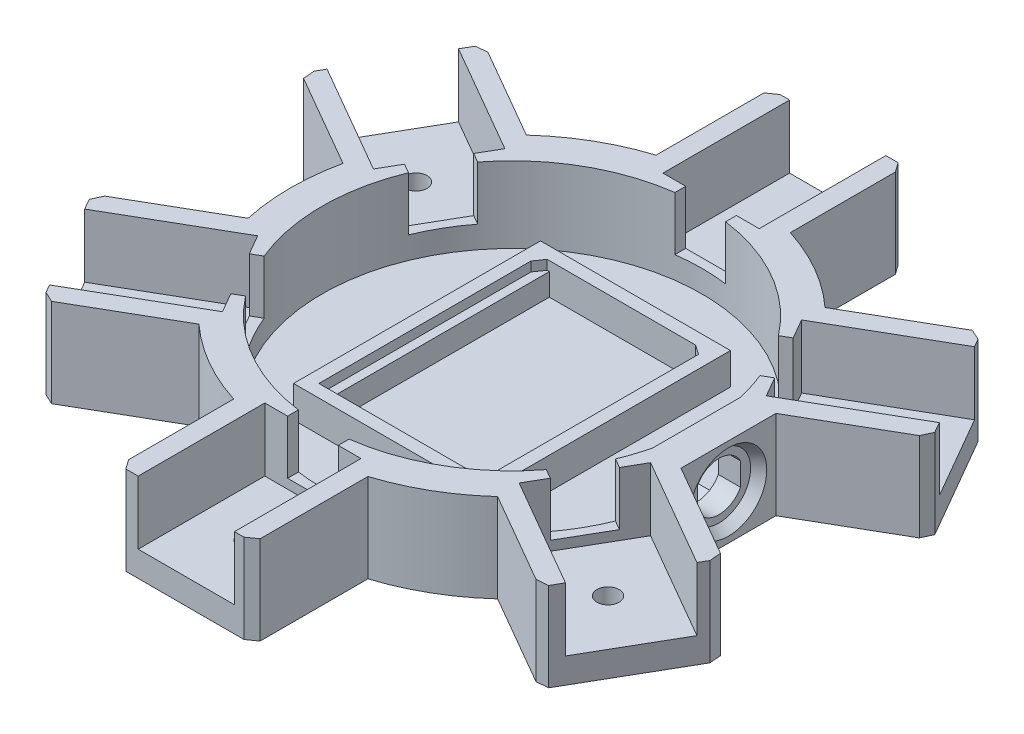
from build123d import *
from OCP.BRepFilletAPI import BRepFilletAPI_MakeChamfer

# Parameters (mm, degrees)
EXTRUDE_1_DEPTH     = 12
EXTRUDE_START       = 2
EXTRUDE_2_DEPTH     = 2
SKETCH_3_W          = 15.199999999999989
SKETCH_3_H          = 19.99999999999999
SKETCH_3_R          = 1.7500000000000004
SKETCH_3_R_2        = 1.7500000000005023
SKETCH_3_R_3        = 1.7500000000022933
SKETCH_3_R_4        = 1.7500000000036793
SKETCH_3_R_5        = 1.7500000000033842
SKETCH_3_R_6        = 1.7500000000018003
EXTRUDE_3_DEPTH     = 2
SKETCH_4_W          = 8
SKETCH_4_H          = 3.321565507275732
CUT_EXTRUDE_1_DEPTH = 8.5
CUT_EXTRUDE_2_DEPTH = 5
SKETCH_7_R          = 5
CUT_EXTRUDE_3_DEPTH = 1.5
CHAMFER_1_SIZE2     = 1.5
CHAMFER_1_SIZE      = 1.050311307
SKETCH_8_R          = 6.250000000000001
CUT_EXTRUDE_4_DEPTH = 5
SKETCH_6_W          = 30.000000000000018
SKETCH_6_H          = 39.00000000000001
EXTRUDE_4_DEPTH     = 5
EXTRUDE_5_DEPTH     = 3.5
CHAMFER_2_SIZE      = 1.5
CHAMFER_2_SIZE2     = 1.0503113073145682
SKETCH_10_R         = 1.7500000000000036
SKETCH_10_R_2       = 1.7500000000006353
SKETCH_10_R_3       = 1.750000000002967
SKETCH_10_R_4       = 1.750000000004767
SKETCH_10_R_5       = 1.7500000000043445
SKETCH_10_R_6       = 1.7500000000022113
CUT_EXTRUDE_5_DEPTH = 73.62872211301196
CHAMFER_3_SIZE      = 1.5
CHAMFER_3_SIZE2     = 1.0503113073145682
CHAMFER_3_SIZE2_2   = 1.0503113073145676
CHAMFER_3_SIZE2_3   = 1.050311307314569
CHAMFER_3_SIZE2_4   = 1.0503113073145678
CHAMFER_3_SIZE2_5   = 1.0503113073145673
CHAMFER_3_SIZE2_6   = 1.050311307314568


with BuildPart() as part:
    # Эскиз1 → Бобышка-Вытянуть1 (new body)
    with BuildSketch(Plane(origin=(0, 0, 0), x_dir=(1, 0, 0), z_dir=(0, 1, 0))):
        with BuildLine():
            Line((-7.599999999999993, 31.44), (-7.599999999999996, 51.44))
            Line((-7.599999999999996, 51.44), (-10.599999999999994, 51.44))
            Line((-10.599999999999994, 51.44), (-10.599999999999993, 33.35625878302303))
            ThreePointArc((-10.599999999999993, 33.35625878302303), (-17.499999999999947, 30.310889132455397), (-23.587367481305645, 25.857998671626635))
            Line((-23.587367481305645, 25.857998671626635), (-39.24834677067146, 34.8998692801151))
            Line((-39.24834677067146, 34.8998692801151), (-40.74834677067145, 32.30179306876178))
            Line((-40.74834677067145, 32.30179306876178), (-23.427838694982682, 22.3017930687618))
            Line((-23.427838694982682, 22.3017930687618), (-31.02783869498267, 9.138206931238326))
            Line((-31.02783869498267, 9.138206931238326), (-48.34834677067144, 19.138206931238315))
            Line((-48.34834677067144, 19.138206931238315), (-49.84834677067145, 16.540130719884996))
            Line((-49.84834677067145, 16.540130719884996), (-34.18736748130565, 7.498260111396523))
            ThreePointArc((-34.18736748130565, 7.498260111396523), (-34.99999999999993, 1.4417e-13), (-34.18736748130567, -7.49826011139625))
            Line((-34.18736748130567, -7.49826011139625), (-49.848346770671455, -16.540130719884772))
            Line((-49.848346770671455, -16.540130719884772), (-48.34834677067145, -19.138206931238084))
            Line((-48.34834677067145, -19.138206931238084), (-31.027838694982687, -9.138206931238079))
            Line((-31.027838694982687, -9.138206931238079), (-23.42783869498268, -22.301793068761537))
            Line((-23.42783869498268, -22.301793068761537), (-40.74834677067144, -32.301793068761555))
            Line((-40.74834677067144, -32.301793068761555), (-39.248346770671446, -34.89986928011487))
            Line((-39.248346770671446, -34.89986928011487), (-23.587367481305666, -25.85799867162636))
            ThreePointArc((-23.587367481305666, -25.85799867162636), (-17.49999999999999, -30.310889132455134), (-10.60000000000007, -33.35625878302277))
            Line((-10.60000000000007, -33.35625878302277), (-10.60000000000005, -51.439999999999756))
            Line((-10.60000000000005, -51.439999999999756), (-7.6000000000000485, -51.439999999999756))
            Line((-7.6000000000000485, -51.439999999999756), (-7.600000000000051, -31.43999999999976))
            Line((-7.600000000000051, -31.43999999999976), (7.599999999999947, -31.43999999999976))
            Line((7.599999999999947, -31.43999999999976), (7.59999999999995, -51.439999999999756))
            Line((7.59999999999995, -51.439999999999756), (10.59999999999995, -51.439999999999756))
            Line((10.59999999999995, -51.439999999999756), (10.599999999999941, -33.35625878302278))
            ThreePointArc((10.599999999999941, -33.35625878302278), (17.499999999999876, -30.310889132455145), (23.58736748130558, -25.85799867162641))
            Line((23.58736748130558, -25.85799867162641), (39.24834677067138, -34.899869280114885))
            Line((39.24834677067138, -34.899869280114885), (40.74834677067138, -32.30179306876157))
            Line((40.74834677067138, -32.30179306876157), (23.427838694982615, -22.30179306876157))
            Line((23.427838694982615, -22.30179306876157), (31.027838694982613, -9.138206931238104))
            Line((31.027838694982613, -9.138206931238104), (48.348346770671384, -19.138206931238102))
            Line((48.348346770671384, -19.138206931238102), (49.848346770671384, -16.540130719884782))
            Line((49.848346770671384, -16.540130719884782), (34.18736748130559, -7.498260111396299))
            Line((34.18736748130559, -7.498260111396299), (34.187367481305614, 7.498260111396479))
            Line((34.187367481305614, 7.498260111396479), (49.848346770671405, 16.540130719884996))
            Line((49.848346770671405, 16.540130719884996), (48.34834677067141, 19.13820693123831))
            Line((48.34834677067141, 19.13820693123831), (31.027838694982638, 9.138206931238308))
            Line((31.027838694982638, 9.138206931238308), (23.427838694982633, 22.301793068761775))
            Line((23.427838694982633, 22.301793068761775), (40.748346770671404, 32.301793068761775))
            Line((40.748346770671404, 32.301793068761775), (39.248346770671404, 34.89986928011509))
            Line((39.248346770671404, 34.89986928011509), (23.587367481305627, 25.857998671626596))
            ThreePointArc((23.587367481305627, 25.857998671626596), (17.499999999999936, 30.31088913245534), (10.600000000000003, 33.35625878302302))
            Line((10.600000000000003, 33.35625878302302), (10.600000000000001, 51.44))
            Line((10.600000000000001, 51.44), (7.600000000000002, 51.44))
            Line((7.600000000000002, 51.44), (7.599999999999993, 31.44))
            Line((7.599999999999993, 31.44), (-7.599999999999993, 31.44))
        make_face()
        with BuildLine():
            Line((29.18736748130573, 6.935241849511566), (29.18736748130574, -6.935241849511548))
            ThreePointArc((29.18736748130574, -6.935241849511548), (-29.999999999999996, -9.65e-15), (29.18736748130573, 6.935241849511566))
        make_face(mode=Mode.SUBTRACT)
    extrude(amount=EXTRUDE_1_DEPTH)

    # Эскиз2 → Бобышка-Вытянуть2 (add)
    with BuildSketch(Plane.XZ.offset(EXTRUDE_START)):
        with BuildLine():
            Line((-10.60000000000005, 51.439999999999756), (10.59999999999995, 51.439999999999756))
            Line((10.59999999999995, 51.439999999999756), (10.599999999999941, 33.35625878302278))
            ThreePointArc((10.599999999999941, 33.35625878302278), (17.499999999999883, 30.31088913245516), (23.58736748130557, 25.8579986716264))
            Line((23.58736748130557, 25.8579986716264), (39.24834677067138, 34.899869280114885))
            Line((39.24834677067138, 34.899869280114885), (49.848346770671384, 16.540130719884782))
            Line((49.848346770671384, 16.540130719884782), (34.18736748130559, 7.498260111396299))
            Line((34.18736748130559, 7.498260111396299), (34.187367481305614, -7.498260111396479))
            Line((34.187367481305614, -7.498260111396479), (49.848346770671405, -16.540130719884996))
            Line((49.848346770671405, -16.540130719884996), (39.248346770671404, -34.89986928011509))
            Line((39.248346770671404, -34.89986928011509), (23.587367481305627, -25.857998671626596))
            ThreePointArc((23.587367481305627, -25.857998671626596), (17.499999999999947, -30.310889132455358), (10.600000000000001, -33.356258783022994))
            Line((10.600000000000001, -33.356258783022994), (10.600000000000001, -51.44))
            Line((10.600000000000001, -51.44), (-10.599999999999994, -51.44))
            Line((-10.599999999999994, -51.44), (-10.599999999999993, -33.35625878302303))
            ThreePointArc((-10.599999999999993, -33.35625878302303), (-17.49999999999994, -30.310889132455387), (-23.587367481305638, -25.857998671626646))
            Line((-23.587367481305638, -25.857998671626646), (-39.24834677067146, -34.8998692801151))
            Line((-39.24834677067146, -34.8998692801151), (-48.34834677067144, -19.138206931238315))
            Line((-48.34834677067144, -19.138206931238315), (-49.84834677067145, -16.540130719884996))
            Line((-49.84834677067145, -16.540130719884996), (-34.18736748130565, -7.498260111396523))
            ThreePointArc((-34.18736748130565, -7.498260111396523), (-34.99999999999991, -1.356e-13), (-34.187367481305685, 7.498260111396258))
            Line((-34.187367481305685, 7.498260111396258), (-49.848346770671455, 16.540130719884772))
            Line((-49.848346770671455, 16.540130719884772), (-39.248346770671446, 34.89986928011487))
            Line((-39.248346770671446, 34.89986928011487), (-23.587367481305666, 25.85799867162636))
            ThreePointArc((-23.587367481305666, 25.85799867162636), (-17.50000000000001, 30.310889132455106), (-10.6000000000001, 33.35625878302277))
            Line((-10.6000000000001, 33.35625878302277), (-10.60000000000005, 51.439999999999756))
        make_face()
    extrude(amount=-EXTRUDE_2_DEPTH)

    # Эскиз3 → Бобышка-Вытянуть3 (add)
    # profile 1 of 6: a face of its own
    with BuildSketch(Plane(origin=(0, 0, 0), x_dir=(1, 0, 0), z_dir=(0, 1, 0))):
        with Locations((-2.22e-15, 41.44)):
            Rectangle(SKETCH_3_W, SKETCH_3_H)
        with Locations(Location((-1.73e-15, 41.440000000000005, 0), (0, 0, 270))):
            Circle(SKETCH_3_R, mode=Mode.SUBTRACT)
    # profile 2 of 6: a face of its own
    with BuildSketch(Plane(origin=(0, 0, 0), x_dir=(1, 0, 0), z_dir=(0, 1, 0))):
        Polygon((40.74834677067241, 32.301793068763274), (48.34834677067242, 19.13820693123983), (31.02783869498364, 9.138206931239816), (23.427838694983645, 22.30179306876327), align=None)
        with Locations(Location((35.88809273282802, 20.72000000000155, 0), (0, 0, 270))):
            Circle(SKETCH_3_R_2, mode=Mode.SUBTRACT)
    # profile 3 of 6: a face of its own
    with BuildSketch(Plane(origin=(0, 0, 0), x_dir=(1, 0, 0), z_dir=(0, 1, 0))):
        Polygon((48.34834677067419, -19.13820693123672), (40.74834677067421, -32.30179306876019), (23.427838694985432, -22.301793068760183), (31.027838694985423, -9.138206931236725), align=None)
        with Locations(Location((35.88809273282982, -20.719999999998457, 0), (0, 0, 270))):
            Circle(SKETCH_3_R_3, mode=Mode.SUBTRACT)
    # profile 4 of 6: a face of its own
    with BuildSketch(Plane(origin=(0, 0, 0), x_dir=(1, 0, 0), z_dir=(0, 1, 0))):
        Polygon((7.600000000003557, -51.44), (-7.599999999996428, -51.44000000000001), (-7.5999999999964345, -31.44), (7.600000000003551, -31.44), align=None)
        with Locations(Location((3.56008e-12, -41.440000000000005, 0), (0, 0, 270))):
            Circle(SKETCH_3_R_4, mode=Mode.SUBTRACT)
    # profile 5 of 6: a face of its own
    with BuildSketch(Plane(origin=(0, 0, 0), x_dir=(1, 0, 0), z_dir=(0, 1, 0))):
        Polygon((-40.74834677066884, -32.301793068763295), (-48.34834677066885, -19.13820693123985), (-31.02783869498008, -9.138206931239829), (-23.42783869498008, -22.30179306876328), align=None)
        with Locations(Location((-35.88809273282446, -20.720000000001555, 0), (0, 0, 270))):
            Circle(SKETCH_3_R_5, mode=Mode.SUBTRACT)
    # profile 6 of 6: a face of its own
    with BuildSketch(Plane(origin=(0, 0, 0), x_dir=(1, 0, 0), z_dir=(0, 1, 0))):
        Polygon((-48.348346770670645, 19.138206931236688), (-40.74834677067068, 32.30179306876016), (-23.427838694981887, 22.30179306876017), (-31.027838694981867, 9.138206931236708), align=None)
        with Locations(Location((-35.888092732826266, 20.719999999998436, 0), (0, 0, 270))):
            Circle(SKETCH_3_R_6, mode=Mode.SUBTRACT)
    extrude(amount=EXTRUDE_3_DEPTH)

    # Эскиз4 → Вырез-Вытянуть1 (cut)
    with BuildSketch(Plane(origin=(0, 12, 0), x_dir=(1, 0, 0), z_dir=(0, 1, 0))):
        Polygon((25.60639352508, 19.40266034819837), (29.606393525080005, 12.474457117922865), (26.729833415445075, 10.813674364285001), (22.72983341544507, 17.74187759456051), align=None)
        with Locations((0, 30.216334712480567)):
            Rectangle(SKETCH_4_W, SKETCH_4_H)
        Polygon((29.606393525081625, -12.474457117920053), (25.60639352508163, -19.402660348195564), (22.7298334154467, -17.7418775945577), (26.729833415446695, -10.81367436428219), align=None)
        Polygon((4.000000000003237, -31.87711746611843), (-3.999999999996763, -31.87711746611843), (-3.999999999996764, -28.555551958842702), (4.0000000000032365, -28.555551958842702), align=None)
        Polygon((-25.60639352507676, -19.40266034819838), (-29.606393525076765, -12.474457117922876), (-26.72983341544184, -10.813674364285008), (-22.729833415441835, -17.741877594560513), align=None)
        Polygon((-29.6063935250784, 12.474457117920036), (-25.606393525078403, 19.40266034819555), (-22.729833415443473, 17.74187759455769), (-26.72983341544347, 10.813674364282175), align=None)
    extrude(amount=-CUT_EXTRUDE_1_DEPTH, mode=Mode.SUBTRACT)

    # Эскиз5 → Вырез-Вытянуть2 (cut)
    with BuildSketch(Plane(origin=(34.1873674813056, 0, 4.746e-14), x_dir=(1.39e-15, 0, -1), z_dir=(1, 0, 1.39e-15))):
        with BuildLine():
            Line((-3.4, 6.806239186818845), (-3.3999999999999986, 3.1937608131811546))
            ThreePointArc((-3.3999999999999986, 3.1937608131811546), (7.316e-14, 1.1499999999998796), (3.4000000000000004, 3.1937608131811555))
            Line((3.4000000000000004, 3.1937608131811555), (3.4, 6.806239186818847))
            ThreePointArc((3.4, 6.806239186818847), (7.145e-14, 8.84999999999988), (-3.4, 6.806239186818845))
        make_face()
    extrude(amount=-CUT_EXTRUDE_2_DEPTH, mode=Mode.SUBTRACT)

    # Эскиз7 → Вырез-Вытянуть3 (cut)
    with BuildSketch(Plane(origin=(34.1873674813056, 0, 4.746e-14), x_dir=(1.39e-15, 0, -1), z_dir=(1, 0, 1.39e-15))):
        with Locations((1.3704e-13, 5)):
            Circle(SKETCH_7_R)
    extrude(amount=-CUT_EXTRUDE_3_DEPTH, mode=Mode.SUBTRACT)

    # Фаска1
    chamfer_1_edges = [part.edges().sort_by_distance(p)[0] for p in [
        (34.18736748130559, 5.000000000000001, 4.99999999999991),
    ]]
    chamfer_1_side = [part.faces().sort_by_distance(p)[0] for p in [
        (34.18736748130559, 5.000000000000001, 5.021006226146202),
    ]]
    chamfer(chamfer_1_edges, length=CHAMFER_1_SIZE - 0.0001, length2=CHAMFER_1_SIZE2 - 0.0001, reference=chamfer_1_side[0])  # a hair under: the kernel refuses the full size

    # Эскиз8 → Вырез-Вытянуть4 (cut)
    with BuildSketch(Plane.ZY.offset(-29.187367481305735)):
        with Locations((-7.532e-14, 5)):
            Circle(SKETCH_8_R)
    extrude(amount=CUT_EXTRUDE_4_DEPTH, mode=Mode.SUBTRACT)

    # Эскиз6 → Бобышка-Вытянуть4 (add)
    with BuildSketch(Plane(origin=(0, 0, 0), x_dir=(1, 0, 0), z_dir=(0, 1, 0))):
        Rectangle(SKETCH_6_W, SKETCH_6_H)
        Polygon((-13.000000000000002, 17.5), (12.999999999999995, 17.5), (13.000000000000002, -17.5), (-13.000000000000002, -17.5), align=None, mode=Mode.SUBTRACT)
    extrude(amount=EXTRUDE_4_DEPTH)

    # Эскиз9 → Бобышка-Вытянуть5 (add)
    with BuildSketch(Plane(origin=(0, 0, 0), x_dir=(1, 0, 0), z_dir=(0, 1, 0))):
        Polygon((-13.000000000000002, 17.5), (-11.600000000000001, 17.5), (-11.599999999999998, -16.1), (11.599999999999998, -16.1), (11.599999999999994, 17.5), (12.999999999999995, 17.5), (12.999999999999995, -17.5), (11.6, -17.5), (-11.599999999999996, -17.5), (-13.000000000000002, -17.5), align=None)
    extrude(amount=EXTRUDE_5_DEPTH)

    # Фаска2: one chamfer whose edges measure the first distance from different faces: ONE call of the kernel's chamfer builder (chamfer() names one face for all edges)
    chamfer_2_edges_1 = [part.edges().sort_by_distance(p)[0] for p in [
        (12.999999999999995, 4.25, -17.5),
    ]]
    chamfer_2_side_1 = [part.faces().sort_by_distance(p)[0] for p in [
        (-4.05e-15, 2.5611480865224623, -17.5),
    ]]
    chamfer_2_edges_2 = [part.edges().sort_by_distance(p)[0] for p in [
        (-13.000000000000002, 4.25, -17.5),
    ]]
    chamfer_2_side_2 = [part.faces().sort_by_distance(p)[0] for p in [
        (-13.000000000000002, 4.25, 6.7e-16),
    ]]
    chamfer_2 = BRepFilletAPI_MakeChamfer(part.part.solid().wrapped)
    for e in chamfer_2_edges_1:
        chamfer_2.Add(CHAMFER_2_SIZE, CHAMFER_2_SIZE2, e.wrapped, chamfer_2_side_1[0].wrapped)  # the first distance lies on this face
    for e in chamfer_2_edges_2:
        chamfer_2.Add(CHAMFER_2_SIZE, CHAMFER_2_SIZE2, e.wrapped, chamfer_2_side_2[0].wrapped)  # the first distance lies on this face
    add(Compound.cast(chamfer_2.Shape()), mode=Mode.REPLACE)

    # Эскиз10 → Вырез-Вытянуть5 (cut, through all)
    with BuildSketch(Plane(origin=(0, 0, 0), x_dir=(1, 0, 0), z_dir=(0, 1, 0))):
        with Locations(Location((-1.73e-15, 41.440000000000005, 0), (0, 0, 270))):
            Circle(SKETCH_10_R)
        with Locations(Location((35.8880927328283, 20.72000000000204, 0), (0, 0, 270))):
            Circle(SKETCH_10_R_2)
        with Locations(Location((35.88809273283067, -20.719999999997967, 0), (0, 0, 270))):
            Circle(SKETCH_10_R_3)
        with Locations(Location((4.69422e-12, -41.440000000000005, 0), (0, 0, 270))):
            Circle(SKETCH_10_R_4)
        with Locations(Location((-35.88809273282361, -20.72000000000205, 0), (0, 0, 270))):
            Circle(SKETCH_10_R_5)
        with Locations(Location((-35.88809273282598, 20.719999999997942, 0), (0, 0, 270))):
            Circle(SKETCH_10_R_6)
    extrude(amount=-CUT_EXTRUDE_5_DEPTH, mode=Mode.SUBTRACT)

    # Фаска3: one chamfer whose edges measure the first distance from different faces: ONE call of the kernel's chamfer builder (chamfer() names one face for all edges)
    chamfer_3_edges_1 = [part.edges().sort_by_distance(p)[0] for p in [
        (10.600000000000001, 5, -51.44),
    ]]
    chamfer_3_side_1 = [part.faces().sort_by_distance(p)[0] for p in [
        (10.600000000000001, 4.999999999999998, -42.3981293915115),
    ]]
    chamfer_3_edges_2 = [part.edges().sort_by_distance(p)[0] for p in [
        (39.248346770671404, 5, -34.89986928011509),
    ]]
    chamfer_3_side_2 = [part.faces().sort_by_distance(p)[0] for p in [
        (40.6213192146058, 7, -32.5218112498287),
    ]]
    chamfer_3_edges_3 = [part.edges().sort_by_distance(p)[0] for p in [
        (49.848346770671405, 5, -16.540130719884996),
    ]]
    chamfer_3_side_3 = [part.faces().sort_by_distance(p)[0] for p in [
        (42.017857125988506, 5, -12.019195415640738),
    ]]
    chamfer_3_edges_4 = [part.edges().sort_by_distance(p)[0] for p in [
        (49.848346770671384, 5, 16.540130719884782),
    ]]
    chamfer_3_side_4 = [part.faces().sort_by_distance(p)[0] for p in [
        (39.99834677067138, 11.745944887868793, 33.60083117443823),
    ]]
    chamfer_3_edges_5 = [part.edges().sort_by_distance(p)[0] for p in [
        (39.24834677067138, 5, 34.899869280114885),
    ]]
    chamfer_3_side_5 = [part.faces().sort_by_distance(p)[0] for p in [
        (31.417857125988476, 4.999999999999999, 30.37893397587065),
    ]]
    chamfer_3_edges_6 = [part.edges().sort_by_distance(p)[0] for p in [
        (10.59999999999995, 5, 51.439999999999756),
    ]]
    chamfer_3_side_6 = [part.faces().sort_by_distance(p)[0] for p in [
        (-9.10000000000005, 11.745944887868793, 51.439999999999756),
    ]]
    chamfer_3_edges_7 = [part.edges().sort_by_distance(p)[0] for p in [
        (-10.60000000000005, 5, 51.439999999999756),
    ]]
    chamfer_3_side_7 = [part.faces().sort_by_distance(p)[0] for p in [
        (-10.60000000000006, 5.000000000000001, 42.39812939151126),
    ]]
    chamfer_3_edges_8 = [part.edges().sort_by_distance(p)[0] for p in [
        (-39.248346770671446, 5, 34.89986928011487),
    ]]
    chamfer_3_side_8 = [part.faces().sort_by_distance(p)[0] for p in [
        (-49.09834677067145, 11.745944887868793, 17.83916882556143),
    ]]
    chamfer_3_edges_9 = [part.edges().sort_by_distance(p)[0] for p in [
        (-49.848346770671455, 5, 16.540130719884772),
    ]]
    chamfer_3_side_9 = [part.faces().sort_by_distance(p)[0] for p in [
        (-42.01785712598857, 5.000000000000002, 12.019195415640514),
    ]]
    chamfer_3_edges_10 = [part.edges().sort_by_distance(p)[0] for p in [
        (-49.84834677067145, 5, -16.540130719884996),
    ]]
    chamfer_3_side_10 = [part.faces().sort_by_distance(p)[0] for p in [
        (-39.99834677067146, 11.745944887868793, -33.60083117443844),
    ]]
    chamfer_3_edges_11 = [part.edges().sort_by_distance(p)[0] for p in [
        (-39.24834677067146, 5, -34.8998692801151),
    ]]
    chamfer_3_side_11 = [part.faces().sort_by_distance(p)[0] for p in [
        (-31.41785712598855, 5, -30.37893397587087),
    ]]
    chamfer_3_edges_12 = [part.edges().sort_by_distance(p)[0] for p in [
        (-10.599999999999994, 5, -51.44),
    ]]
    chamfer_3_side_12 = [part.faces().sort_by_distance(p)[0] for p in [
        (9.100000000000001, 11.745944887868793, -51.44),
    ]]
    chamfer_3 = BRepFilletAPI_MakeChamfer(part.part.solid().wrapped)
    for e in chamfer_3_edges_1:
        chamfer_3.Add(CHAMFER_3_SIZE, CHAMFER_3_SIZE2, e.wrapped, chamfer_3_side_1[0].wrapped)  # the first distance lies on this face
    for e in chamfer_3_edges_2:
        chamfer_3.Add(CHAMFER_3_SIZE, CHAMFER_3_SIZE2_2, e.wrapped, chamfer_3_side_2[0].wrapped)  # the first distance lies on this face
    for e in chamfer_3_edges_3:
        chamfer_3.Add(CHAMFER_3_SIZE, CHAMFER_3_SIZE2_3, e.wrapped, chamfer_3_side_3[0].wrapped)  # the first distance lies on this face
    for e in chamfer_3_edges_4:
        chamfer_3.Add(CHAMFER_3_SIZE, CHAMFER_3_SIZE2_4, e.wrapped, chamfer_3_side_4[0].wrapped)  # the first distance lies on this face
    for e in chamfer_3_edges_5:
        chamfer_3.Add(CHAMFER_3_SIZE, CHAMFER_3_SIZE2_3, e.wrapped, chamfer_3_side_5[0].wrapped)  # the first distance lies on this face
    for e in chamfer_3_edges_6:
        chamfer_3.Add(CHAMFER_3_SIZE, CHAMFER_3_SIZE2_4, e.wrapped, chamfer_3_side_6[0].wrapped)  # the first distance lies on this face
    for e in chamfer_3_edges_7:
        chamfer_3.Add(CHAMFER_3_SIZE, CHAMFER_3_SIZE2_3, e.wrapped, chamfer_3_side_7[0].wrapped)  # the first distance lies on this face
    for e in chamfer_3_edges_8:
        chamfer_3.Add(CHAMFER_3_SIZE, CHAMFER_3_SIZE2_3, e.wrapped, chamfer_3_side_8[0].wrapped)  # the first distance lies on this face
    for e in chamfer_3_edges_9:
        chamfer_3.Add(CHAMFER_3_SIZE, CHAMFER_3_SIZE2_5, e.wrapped, chamfer_3_side_9[0].wrapped)  # the first distance lies on this face
    for e in chamfer_3_edges_10:
        chamfer_3.Add(CHAMFER_3_SIZE, CHAMFER_3_SIZE2_3, e.wrapped, chamfer_3_side_10[0].wrapped)  # the first distance lies on this face
    for e in chamfer_3_edges_11:
        chamfer_3.Add(CHAMFER_3_SIZE, CHAMFER_3_SIZE2, e.wrapped, chamfer_3_side_11[0].wrapped)  # the first distance lies on this face
    for e in chamfer_3_edges_12:
        chamfer_3.Add(CHAMFER_3_SIZE, CHAMFER_3_SIZE2_6, e.wrapped, chamfer_3_side_12[0].wrapped)  # the first distance lies on this face
    add(Compound.cast(chamfer_3.Shape()), mode=Mode.REPLACE)


solid = part.part
